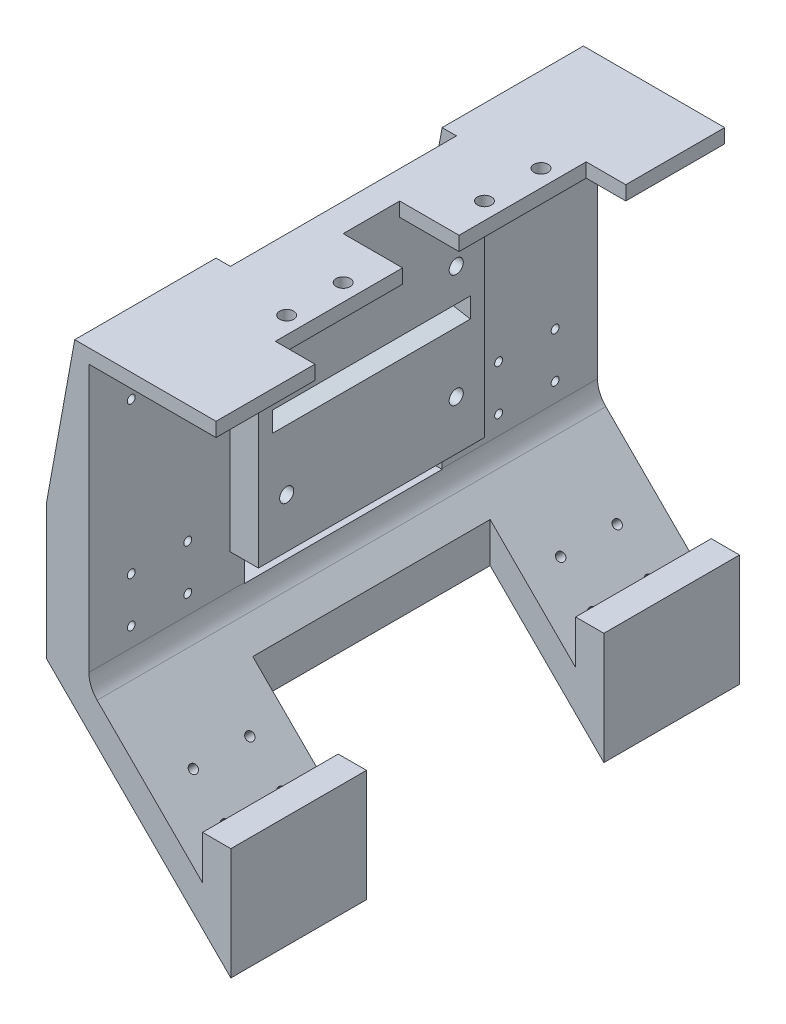
from build123d import *

# Parameters (mm, degrees)
BOSS_EXTRUDE2_DEPTH = 180
SKETCH2_R           = 2.5
CUT_EXTRUDE1_DEPTH  = 180
SKETCH3_W           = 10
SKETCH3_H           = 82.5
CUT_EXTRUDE2_DEPTH  = 35
BOSS_EXTRUDE3_DEPTH = 34
CUT_EXTRUDE3_DEPTH  = 205.147272565
SKETCH6_R           = 2.5
CUT_EXTRUDE4_DEPTH  = 34
CUT_EXTRUDE5_DEPTH  = 5
SKETCH8_W           = 80
SKETCH8_H           = 62.155508182
CUT_EXTRUDE8_DEPTH  = 7
CUT_EXTRUDE9_DEPTH  = 205.147272565
SKETCH11_W          = 10
SKETCH11_H          = 35
BOSS_EXTRUDE4_DEPTH = 5
SKETCH12_W          = 15
SKETCH12_H          = 82.5
CUT_EXTRUDE11_DEPTH = 10
SKETCH10_R          = 1.4
CUT_EXTRUDE10_DEPTH = 18
SKETCH14_R          = 1.4
CUT_EXTRUDE12_DEPTH = 211.50767784
BOSS_EXTRUDE5_DEPTH = 14
SKETCH16_R          = 1.5
CUT_EXTRUDE13_DEPTH = 219.238688301
SKETCH17_W          = 70
SKETCH17_H          = 7
CUT_EXTRUDE14_DEPTH = 210.498896517
SKETCH18_W          = 70
SKETCH18_H          = 10
CUT_EXTRUDE15_DEPTH = 209.444279941
BOSS_EXTRUDE6_DEPTH = 48
FILLET1_R           = 10


# Read off the part's stored shape, not the designer's step: Boss-Extrude2
with BuildPart() as part:
    # Boss-Extrude2 outline → Boss-Extrude2 (new body)
    with BuildSketch(Plane.XY):
        Polygon((-25, 32.5), (-25, -32.5), (-15, -87.5), (25, -87.5), (25, -82.5), (0, -82.5), (0, 82.5), (25, 82.5), (25, 87.5), (-15, 87.5), align=None)
    extrude(amount=BOSS_EXTRUDE2_DEPTH)

    # Sketch2 → Cut-Extrude1 (cut)
    with BuildSketch(Plane(origin=(0, 87.5, 0), x_dir=(1, 0, 0), z_dir=(0, 1, 0))):
        Polygon((25, -35), (21, -35), (21, -80), (0, -80), (0, -100), (21, -100), (21, -145), (25, -145), align=None)
        with Locations(Location((15, -45, 0), (0, 0, 270))):
            Circle(SKETCH2_R)
        with Locations(Location((15, -65, 0), (0, 0, 270))):
            Circle(SKETCH2_R)
        with Locations(Location((15, -115, 0), (0, 0, 270))):
            Circle(SKETCH2_R)
        with Locations(Location((15, -135, 0), (0, 0, 270))):
            Circle(SKETCH2_R)
    extrude(amount=-CUT_EXTRUDE1_DEPTH, mode=Mode.SUBTRACT)

    # Sketch3 → Cut-Extrude2 (cut)
    with BuildSketch(Plane.XY.offset(180)):
        with Locations((-5, 41.25)):
            Rectangle(SKETCH3_W, SKETCH3_H)
    cut_extrude2 = extrude(amount=-CUT_EXTRUDE2_DEPTH, mode=Mode.SUBTRACT)

    # Mirror1: Cut-Extrude2 across plane
    add(cut_extrude2.mirror(Plane.XY.offset(90)), mode=Mode.SUBTRACT)

    # Sketch4 → Boss-Extrude3 (add)
    with BuildSketch(Plane.XY.offset(180)):
        Polygon((-10, 0), (40.247470675, -50.247470675), (40.247470675, -80.498358966), (-25, -15.250888291), align=None)
    boss_extrude3 = extrude(amount=-BOSS_EXTRUDE3_DEPTH)

    # Mirror2: Boss-Extrude3 across plane
    add(boss_extrude3.mirror(Plane.XY.offset(90)))

    # Sketch5 → Cut-Extrude3 (cut, through all)
    with BuildSketch(Plane.XY.offset(180)):
        Polygon((0, 0), (-10, 0), (0, -10), align=None)
        Polygon((0, -40.250888291), (-25, -15.250888291), (-25, -32.5), (-15, -87.5), (25, -87.5), (25, -82.5), (0, -82.5), align=None)
    extrude(amount=-CUT_EXTRUDE3_DEPTH, mode=Mode.SUBTRACT)

    # Sketch6 → Cut-Extrude4 (cut)
    with BuildSketch(Plane(origin=(0, 0, 0), x_dir=(0, 0, -1), z_dir=(1, 0, 0))):
        with Locations(Location((-120, 57.5, 0), (0, 0, 90))):
            Circle(SKETCH6_R)
        with Locations(Location((-60, 57.5, 0), (0, 0, 90))):
            Circle(SKETCH6_R)
        with Locations(Location((-120, 17.5, 0), (0, 0, 90))):
            Circle(SKETCH6_R)
        with Locations(Location((-60, 17.5, 0), (0, 0, 90))):
            Circle(SKETCH6_R)
    extrude(amount=-CUT_EXTRUDE4_DEPTH, mode=Mode.SUBTRACT)

    # Sketch7 → Cut-Extrude5 (cut)
    with BuildSketch(Plane(origin=(-29.92, 5.44, 0), x_dir=(0, 0, 1), z_dir=(-0.9838699100999075, 0.17888543819998307, 0))):
        Polygon((50, 83.405335561), (50, 27.503636123), (130, 27.503636123), (130, 85.782619375), (130, 90.970472455), (50, 90.970472455), align=None)
    extrude(amount=-CUT_EXTRUDE5_DEPTH, mode=Mode.SUBTRACT)

    # Sketch8 → Cut-Extrude8 (cut)
    with BuildSketch(Plane.ZY.offset(25)):
        with Locations((90, 5.923338625)):
            Rectangle(SKETCH8_W, SKETCH8_H)
    extrude(amount=-CUT_EXTRUDE8_DEPTH, mode=Mode.SUBTRACT)

    # Sketch9 → Cut-Extrude9 (cut, through all)
    with BuildSketch(Plane.XY.offset(180)):
        Polygon((-10, 0), (40.247470675, -50.247470675), (40.247470675, -66.356223342), (-10, -16.108752667), align=None)
    extrude(amount=-CUT_EXTRUDE9_DEPTH, mode=Mode.SUBTRACT)

    # Sketch11 → Boss-Extrude4 (add)
    with BuildSketch(Plane(origin=(0, 87.5, 0), x_dir=(1, 0, 0), z_dir=(0, 1, 0))):
        with Locations((30, -17.5)):
            Rectangle(SKETCH11_W, SKETCH11_H)
        with Locations((30, -162.5)):
            Rectangle(SKETCH11_W, SKETCH11_H)
    extrude(amount=-BOSS_EXTRUDE4_DEPTH)

    # Sketch12 → Cut-Extrude11 (cut)
    with BuildSketch(Plane(origin=(0, 0, 0), x_dir=(0, 0, -1), z_dir=(1, 0, 0))):
        with Locations((-137.5, 41.25)):
            Rectangle(SKETCH12_W, SKETCH12_H)
        with Locations((-42.5, 41.25)):
            Rectangle(SKETCH12_W, SKETCH12_H)
    extrude(amount=-CUT_EXTRUDE11_DEPTH, mode=Mode.SUBTRACT)

    # Sketch10 → Cut-Extrude10 (cut)
    with BuildSketch(Plane(origin=(-29.92, 5.44, 0), x_dir=(0, 0, 1), z_dir=(-0.9838699100999075, 0.17888543819998307, 0))):
        with Locations(Location((165, 77.405335561, 0), (0, 0, 270))):
            Circle(SKETCH10_R)
        with Locations(Location((145, 77.405335561, 0), (0, 0, 270))):
            Circle(SKETCH10_R)
        with Locations(Location((145, 61.405335561, 0), (0, 0, 270))):
            Circle(SKETCH10_R)
        with Locations(Location((165, 61.405335561, 0), (0, 0, 270))):
            Circle(SKETCH10_R)
    cut_extrude10 = extrude(amount=-CUT_EXTRUDE10_DEPTH, mode=Mode.SUBTRACT)

    # Mirror3: Cut-Extrude10 across plane
    add(cut_extrude10.mirror(Plane.XY.offset(90)), mode=Mode.SUBTRACT)

    # Sketch14 → Cut-Extrude12 (cut, through all)
    with BuildSketch(Plane.ZY.offset(25)):
        with Locations((165, -5.250888291)):
            Circle(SKETCH14_R)
        with Locations((145, -5.250888291)):
            Circle(SKETCH14_R)
        with Locations((145, 10.749111709)):
            Circle(SKETCH14_R)
        with Locations((165, 10.749111709)):
            Circle(SKETCH14_R)
    cut_extrude12 = extrude(amount=-CUT_EXTRUDE12_DEPTH, mode=Mode.SUBTRACT)

    # Sketch15 → Boss-Extrude5 (add)
    with BuildSketch(Plane(origin=(0, 0, 146), x_dir=(-1, 0, 0), z_dir=(0, 0, -1))):
        Polygon((0, -40.250888291), (0, -26.108752667), (-40.247470675, -66.356223342), (-40.247470675, -80.498358966), align=None)
    boss_extrude5 = extrude(amount=BOSS_EXTRUDE5_DEPTH)

    # Mirror4: Boss-Extrude5 across plane
    add(boss_extrude5.mirror(Plane.XY.offset(90)))

    # Mirror5: Cut-Extrude12 across plane
    add(cut_extrude12.mirror(Plane.XY.offset(90)), mode=Mode.SUBTRACT)

    # Sketch16 → Cut-Extrude13 (cut, through all)
    with BuildSketch(Plane(origin=(-20.125444145, -20.125444145, 0), x_dir=(0, 0, 1), z_dir=(-0.7071067811865476, -0.7071067811865476, 0))):
        with Locations(Location((165, -35.380194939, 0), (0, 0, 270))):
            Circle(SKETCH16_R)
        with Locations(Location((145, -35.380194939, 0), (0, 0, 270))):
            Circle(SKETCH16_R)
        with Locations(Location((145, -51.380194939, 0), (0, 0, 270))):
            Circle(SKETCH16_R)
        with Locations(Location((165, -51.380194939, 0), (0, 0, 270))):
            Circle(SKETCH16_R)
    cut_extrude13 = extrude(amount=-CUT_EXTRUDE13_DEPTH, mode=Mode.SUBTRACT)

    # Mirror6: Cut-Extrude13 across plane
    add(cut_extrude13.mirror(Plane.XY.offset(90)), mode=Mode.SUBTRACT)

    # Sketch17 → Cut-Extrude14 (cut, through all)
    with BuildSketch(Plane(origin=(-25.00065045, 4.545572809, 0), x_dir=(0, 0, 1), z_dir=(-0.9838699100999075, 0.17888543819998304, 0))):
        with Locations((90, 41.684323876)):
            Rectangle(SKETCH17_W, SKETCH17_H)
    extrude(amount=-CUT_EXTRUDE14_DEPTH, mode=Mode.SUBTRACT)

    # Sketch18 → Cut-Extrude15 (cut, through all)
    with BuildSketch(Plane.ZY.offset(18)):
        with Locations((90, -7.250888291)):
            Rectangle(SKETCH18_W, SKETCH18_H)
    extrude(amount=-CUT_EXTRUDE15_DEPTH, mode=Mode.SUBTRACT)

    # Sketch19 → Boss-Extrude6 (add)
    with BuildSketch(Plane.XY.offset(180)):
        Polygon((30.247470675, -56.356223342), (40.247470675, -66.356223342), (40.247470675, -40.856223342), (30.247470675, -40.856223342), align=None)
    boss_extrude6 = extrude(amount=-BOSS_EXTRUDE6_DEPTH)

    # Mirror7: Boss-Extrude6 across plane
    add(boss_extrude6.mirror(Plane.XY.offset(90)))

    # Fillet1
    # the kernel refuses this fillet: 10 mm, written as the material it adds along each edge
    with BuildSketch(Plane(origin=(-10, -16.108752667, 180), x_dir=(0, 1, 0), z_dir=(0, 0, -1))) as fillet1_piece_1_section:
        with BuildLine():
            CenterArc((FILLET1_R * 0.414213562373, FILLET1_R), FILLET1_R, 225, 45)
            Line((-FILLET1_R * 0.292893218813, FILLET1_R * 0.292893218813), (0, 0))
            Line((0, 0), (FILLET1_R * 0.414213562373, 0))
        make_face()
    fillet1_piece_1 = extrude(amount=180, mode=Mode.PRIVATE)
    fillet1_piece_1 = split(fillet1_piece_1, bisect_by=Plane(origin=(-10.099322896, -12.109228126, 125), z_dir=(0, 0, 1)), keep=Keep.TOP, mode=Mode.PRIVATE)
    fillet1_piece_1 = split(fillet1_piece_1, bisect_by=Plane(origin=(-10.099322896, -12.250888291, 152.5), z_dir=(0, 1, 0)), keep=Keep.TOP, mode=Mode.PRIVATE)
    add(fillet1_piece_1)
    with BuildSketch(Plane(origin=(-10, -16.108752667, 180), x_dir=(0, 1, 0), z_dir=(0, 0, -1))) as fillet1_piece_2_section:
        with BuildLine():
            CenterArc((FILLET1_R * 0.414213562373, FILLET1_R), FILLET1_R, 225, 45)
            Line((-FILLET1_R * 0.292893218813, FILLET1_R * 0.292893218813), (0, 0))
            Line((0, 0), (FILLET1_R * 0.414213562373, 0))
        make_face()
    fillet1_piece_2 = extrude(amount=180, mode=Mode.PRIVATE)
    fillet1_piece_2 = split(fillet1_piece_2, bisect_by=Plane(origin=(-9.370999607, -15.909597181, 125), z_dir=(0, 0, 1)), keep=Keep.TOP, mode=Mode.PRIVATE)
    fillet1_piece_2 = split(fillet1_piece_2, bisect_by=Plane(origin=(-9.370999607, -12.250888291, 152.5), z_dir=(0, -1, 0)), keep=Keep.TOP, mode=Mode.PRIVATE)
    add(fillet1_piece_2)
    with BuildSketch(Plane(origin=(-10, -16.108752667, 180), x_dir=(0, 1, 0), z_dir=(0, 0, -1))) as fillet1_piece_3_section:
        with BuildLine():
            CenterArc((FILLET1_R * 0.414213562373, FILLET1_R), FILLET1_R, 225, 45)
            Line((-FILLET1_R * 0.292893218813, FILLET1_R * 0.292893218813), (0, 0))
            Line((0, 0), (FILLET1_R * 0.414213562373, 0))
        make_face()
    fillet1_piece_3 = extrude(amount=180, mode=Mode.PRIVATE)
    fillet1_piece_3 = split(fillet1_piece_3, bisect_by=Plane(origin=(-9.370999607, -15.909597181, 125), z_dir=(0, 0, -1)), keep=Keep.TOP, mode=Mode.PRIVATE)
    fillet1_piece_3 = split(fillet1_piece_3, bisect_by=Plane(origin=(-9.370999607, -12.250888291, 90), z_dir=(0, -1, 0)), keep=Keep.TOP, mode=Mode.PRIVATE)
    fillet1_piece_3 = split(fillet1_piece_3, bisect_by=Plane(origin=(-9.370999607, -15.909597181, 55), z_dir=(0, 0, 1)), keep=Keep.TOP, mode=Mode.PRIVATE)
    add(fillet1_piece_3)
    with BuildSketch(Plane(origin=(-10, -16.108752667, 180), x_dir=(0, 1, 0), z_dir=(0, 0, -1))) as fillet1_piece_4_section:
        with BuildLine():
            CenterArc((FILLET1_R * 0.414213562373, FILLET1_R), FILLET1_R, 225, 45)
            Line((-FILLET1_R * 0.292893218813, FILLET1_R * 0.292893218813), (0, 0))
            Line((0, 0), (FILLET1_R * 0.414213562373, 0))
        make_face()
    fillet1_piece_4 = extrude(amount=180, mode=Mode.PRIVATE)
    fillet1_piece_4 = split(fillet1_piece_4, bisect_by=Plane(origin=(-10.099322896, -12.250888291, 27.5), z_dir=(0, 1, 0)), keep=Keep.TOP, mode=Mode.PRIVATE)
    fillet1_piece_4 = split(fillet1_piece_4, bisect_by=Plane(origin=(-10.099322896, -12.109228126, 55), z_dir=(0, 0, -1)), keep=Keep.TOP, mode=Mode.PRIVATE)
    add(fillet1_piece_4)
    with BuildSketch(Plane(origin=(-10, -16.108752667, 180), x_dir=(0, 1, 0), z_dir=(0, 0, -1))) as fillet1_piece_5_section:
        with BuildLine():
            CenterArc((FILLET1_R * 0.414213562373, FILLET1_R), FILLET1_R, 225, 45)
            Line((-FILLET1_R * 0.292893218813, FILLET1_R * 0.292893218813), (0, 0))
            Line((0, 0), (FILLET1_R * 0.414213562373, 0))
        make_face()
    fillet1_piece_5 = extrude(amount=180, mode=Mode.PRIVATE)
    fillet1_piece_5 = split(fillet1_piece_5, bisect_by=Plane(origin=(-9.370999607, -12.250888291, 27.5), z_dir=(0, -1, 0)), keep=Keep.TOP, mode=Mode.PRIVATE)
    fillet1_piece_5 = split(fillet1_piece_5, bisect_by=Plane(origin=(-9.370999607, -15.909597181, 55), z_dir=(0, 0, -1)), keep=Keep.TOP, mode=Mode.PRIVATE)
    add(fillet1_piece_5)


solid = part.part
